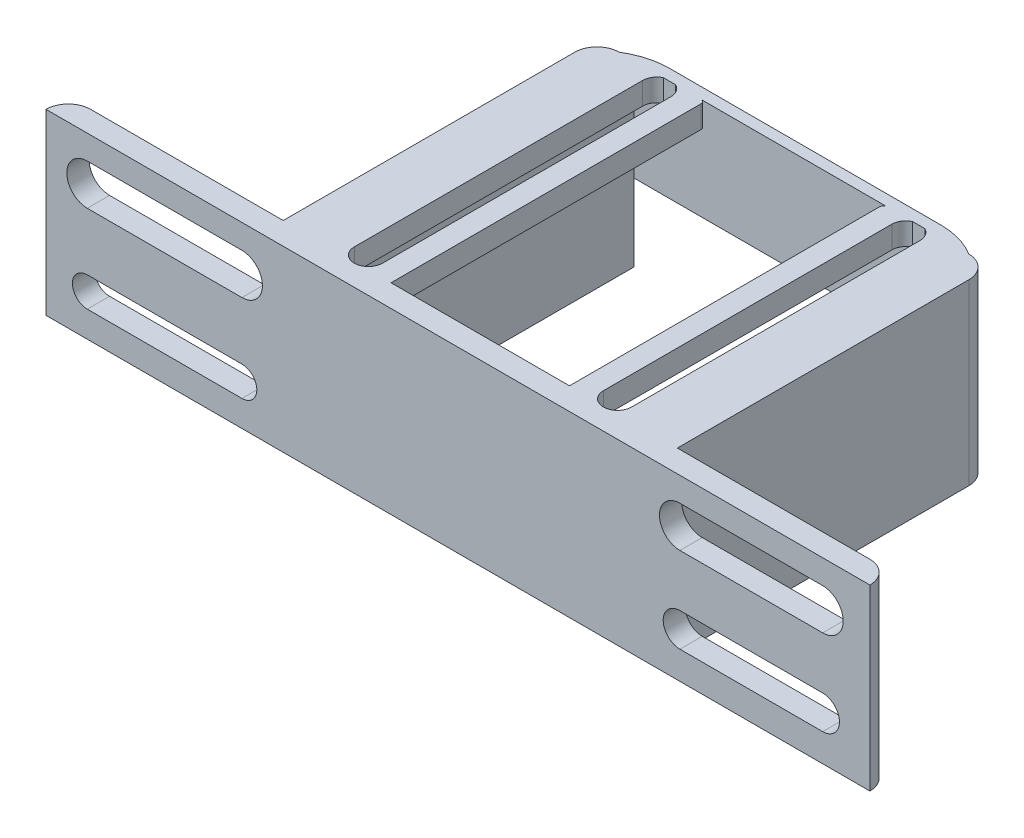
from build123d import *

# Parameters (mm, degrees)
BOSS_EXTRUDE5_DEPTH = 24
SKETCH3_W           = 9.5
SKETCH3_H           = 3
BOSS_EXTRUDE7_DEPTH = 42.2
CUT_EXTRUDE3_DEPTH  = 42.2
CUT_EXTRUDE4_DEPTH  = 42.2
FILLET1_R           = 3
FILLET2_R           = 3
FILLET3_R           = 0.5
FILLET4_R           = 0.5
FILLET5_R           = 3
FILLET6_R           = 3
CUT_EXTRUDE5_DEPTH  = 42.2
CUT_EXTRUDE6_DEPTH  = 42.2
CUT_EXTRUDE7_DEPTH  = 42.2
SKETCH8_W           = 47
SKETCH8_H           = 13.670613598
BOSS_EXTRUDE8_DEPTH = 1.5
FILLET7_R           = 10


# Some blends are built 0.0001 mm under size
with BuildPart() as part:
    # Sketch1 → Boss-Extrude5 (new body)
    with BuildSketch(Plane(origin=(0, 0, 0), x_dir=(1, 0, 0), z_dir=(0, 1, 0))):
        Polygon((-55.4, 0), (55.4, 0), (55.4, 3), (26.5, 3), (26.5, 45.2), (21.5, 45.2), (21.5, 3), (-21.5, 3), (-21.5, 45.2), (-26.5, 45.2), (-26.5, 3), (-55.4, 3), align=None)
    extrude(amount=BOSS_EXTRUDE5_DEPTH)

    # Sketch3 → Boss-Extrude7 (add)
    with BuildSketch(Plane(origin=(0, 0, -3), x_dir=(-1, 0, 0), z_dir=(0, 0, -1))):
        with Locations((-16.75, 22.5)):
            Rectangle(SKETCH3_W, SKETCH3_H)
        with Locations((16.75, 22.5)):
            Rectangle(SKETCH3_W, SKETCH3_H)
    extrude(amount=BOSS_EXTRUDE7_DEPTH)

    # Sketch5 → Cut-Extrude3 (cut)
    with BuildSketch(Plane(origin=(0, 21, 0), x_dir=(-1, 0, 0), z_dir=(0, -1, 0))):
        with BuildLine():
            Line((-14.85, 43.490720045), (-14.85, 4.709279955))
            ThreePointArc((-14.85, 4.709279955), (-16.75, 2.809279955), (-18.65, 4.709279955))
            Line((-18.65, 4.709279955), (-18.65, 43.490720045))
            ThreePointArc((-18.65, 43.490720045), (-16.75, 45.390720045), (-14.85, 43.490720045))
        make_face()
    extrude(amount=-CUT_EXTRUDE3_DEPTH, mode=Mode.SUBTRACT)

    # Sketch5<4> → Cut-Extrude4 (cut)
    with BuildSketch(Plane(origin=(0, 21, 0), x_dir=(-1, 0, 0), z_dir=(0, -1, 0))):
        with BuildLine():
            Line((14.85, 4.709279955), (14.85, 43.490720045))
            ThreePointArc((14.85, 43.490720045), (16.75, 45.390720045), (18.65, 43.490720045))
            Line((18.65, 43.490720045), (18.65, 4.709279955))
            ThreePointArc((18.65, 4.709279955), (16.75, 2.809279955), (14.85, 4.709279955))
        make_face()
    extrude(amount=-CUT_EXTRUDE4_DEPTH, mode=Mode.SUBTRACT)

    # Fillet1
    fillet1_edges = [part.edges().sort_by_distance(p)[0] for p in [
        (-26.5, 12, -45.2),
    ]]
    fillet(fillet1_edges, radius=FILLET1_R)

    # Fillet2
    fillet2_edges = [part.edges().sort_by_distance(p)[0] for p in [
        (26.5, 12, -45.2),
    ]]
    fillet(fillet2_edges, radius=FILLET2_R)

    # Fillet3
    fillet3_edges = [part.edges().sort_by_distance(p)[0] for p in [
        (-12, 22.5, -45.2),
    ]]
    fillet(fillet3_edges, radius=FILLET3_R)

    # Fillet4
    fillet4_edges = [part.edges().sort_by_distance(p)[0] for p in [
        (12, 22.5, -45.2),
    ]]
    fillet(fillet4_edges, radius=FILLET4_R)

    # Fillet5
    fillet5_edges = [part.edges().sort_by_distance(p)[0] for p in [
        (55.4, 12, -3),
    ]]
    fillet(fillet5_edges, radius=FILLET5_R - 0.0001)  # a hair under: the kernel refuses the full size

    # Fillet6
    fillet6_edges = [part.edges().sort_by_distance(p)[0] for p in [
        (-55.4, 12, -3),
    ]]
    fillet(fillet6_edges, radius=FILLET6_R - 0.0001)  # a hair under: the kernel refuses the full size

    # Sketch6 → Cut-Extrude5 (cut)
    with BuildSketch(Plane(origin=(0, 0, -3), x_dir=(-1, 0, 0), z_dir=(0, 0, -1))):
        with BuildLine():
            Line((-29.85, 15.25), (-49.05, 15.25))
            ThreePointArc((-49.05, 15.25), (-51.8, 18), (-49.05, 20.75))
            Line((-49.05, 20.75), (-29.85, 20.75))
            ThreePointArc((-29.85, 20.75), (-27.1, 18), (-29.85, 15.25))
        make_face()
        with BuildLine():
            Line((-29.85, 3.75), (-49.05, 3.75))
            ThreePointArc((-49.05, 3.75), (-51.3, 6), (-49.05, 8.25))
            Line((-49.05, 8.25), (-29.85, 8.25))
            ThreePointArc((-29.85, 8.25), (-27.6, 6), (-29.85, 3.75))
        make_face()
    extrude(amount=-CUT_EXTRUDE5_DEPTH, mode=Mode.SUBTRACT)

    # Sketch7 → Cut-Extrude6 (cut)
    with BuildSketch(Plane(origin=(0, 0, -3), x_dir=(-1, 0, 0), z_dir=(0, 0, -1))):
        with BuildLine():
            Line((49.85, 15.25), (29.05, 15.25))
            ThreePointArc((29.05, 15.25), (26.3, 18), (29.05, 20.75))
            Line((29.05, 20.75), (49.85, 20.75))
            ThreePointArc((49.85, 20.75), (52.6, 18), (49.85, 15.25))
        make_face()
    extrude(amount=-CUT_EXTRUDE6_DEPTH, mode=Mode.SUBTRACT)

    # Sketch7<3> → Cut-Extrude7 (cut)
    with BuildSketch(Plane(origin=(0, 0, -3), x_dir=(-1, 0, 0), z_dir=(0, 0, -1))):
        with BuildLine():
            Line((29.05, 7.503040911), (49.85, 7.503040911))
            ThreePointArc((49.85, 7.503040911), (51.85, 5.503040911), (49.85, 3.503040911))
            Line((49.85, 3.503040911), (29.05, 3.503040911))
            ThreePointArc((29.05, 3.503040911), (27.05, 5.503040911), (29.05, 7.503040911))
        make_face()
    extrude(amount=-CUT_EXTRUDE7_DEPTH, mode=Mode.SUBTRACT)

    # Sketch8 → Boss-Extrude8 (add)
    with BuildSketch(Plane(origin=(0, 0, -45.2), x_dir=(-1, 0, 0), z_dir=(0, 0, -1))):
        with Locations((0, 17.164693201)):
            Rectangle(SKETCH8_W, SKETCH8_H)
    extrude(amount=BOSS_EXTRUDE8_DEPTH)

    # Fillet7
    # the kernel refuses this fillet: 10 mm, written as the material it takes off along each edge
    with BuildSketch(Plane(origin=(23.5, 37.169567191, -46.7), x_dir=(0, 0, 1), z_dir=(0, -1, 0)), Plane(origin=(-23.5, -2.840180789, -46.7), x_dir=(0, 0, 1), z_dir=(0, 1, 0))) as fillet7_piece_1:
        with BuildLine():
            CenterArc((10, 5.267826876), FILLET7_R, 180, 31.788330617)
            Line((0, 5.267826876), (-0.2, 5.267826876))
            Line((-0.2, 5.267826876), (-0.2, 0))
            Line((-0.2, 0), (0, -0.2))
            ThreePointArc((0, -0.2), (0.75, -0.2), (1.33, -0.105356538))
            Line((1.33, -0.105356538), (1.5, 0))
        make_face()
    extrude(amount=40.00974798, mode=Mode.SUBTRACT)


solid = part.part
